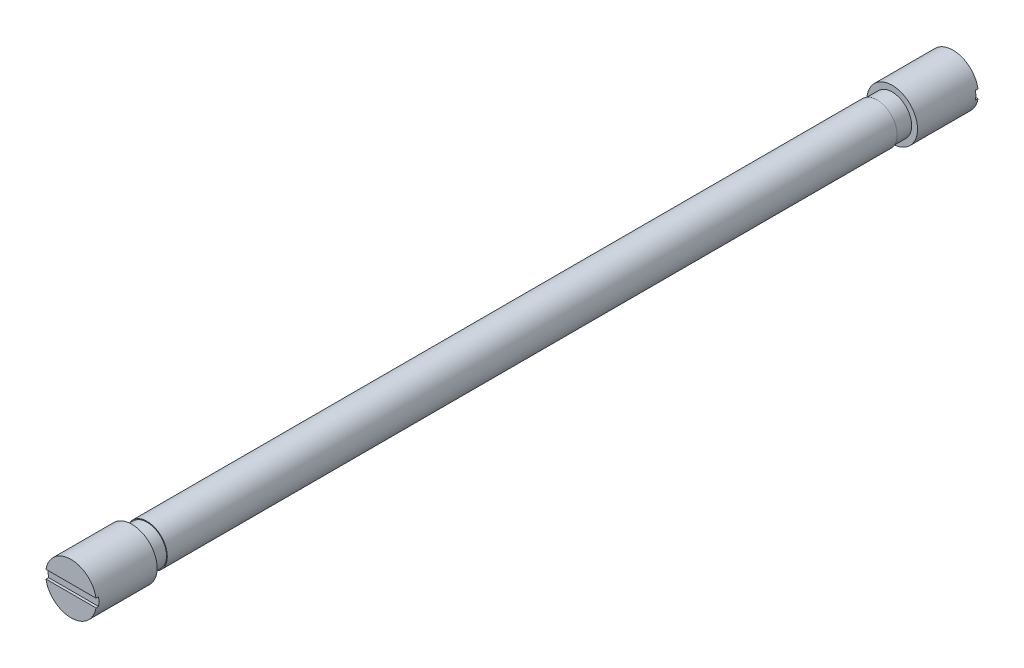
from build123d import *

# Parameters (mm, degrees)
ESQUISSE4_W             = 11.666620124
ESQUISSE4_H             = 1.663113932
ENL_V_MAT_EXTRU_2_DEPTH = 0.5


with BuildPart() as part:
    # Esquisse2 → Révolution1 (revolve)
    with BuildSketch(Plane(origin=(0, 0, 0), x_dir=(0, 0, -1), z_dir=(1, 0, 0))):
        Polygon((-87, 0), (87, 0), (87, 5), (75, 5), (75, 3.85), (72, 3.85), (72, 4), (-72, 4), (-72, 3.85), (-75, 3.85), (-75, 5), (-87, 5), align=None)
    revolve(axis=Axis((0, 0, 51), (0, 0, -1)))

    # Esquisse4 → Enlèv. mat.-Extru.2 (cut)
    with BuildSketch(Plane(origin=(0, 0, -87), x_dir=(-1, 0, 0), z_dir=(0, 0, -1))):
        Rectangle(ESQUISSE4_W, ESQUISSE4_H)
    enl_v_mat_extru_2 = extrude(amount=-ENL_V_MAT_EXTRU_2_DEPTH, mode=Mode.SUBTRACT)

    # Symétrie2: Enlèv. mat.-Extru.2 across plane
    add(enl_v_mat_extru_2.mirror(Plane.XY), mode=Mode.SUBTRACT)


solid = part.part
